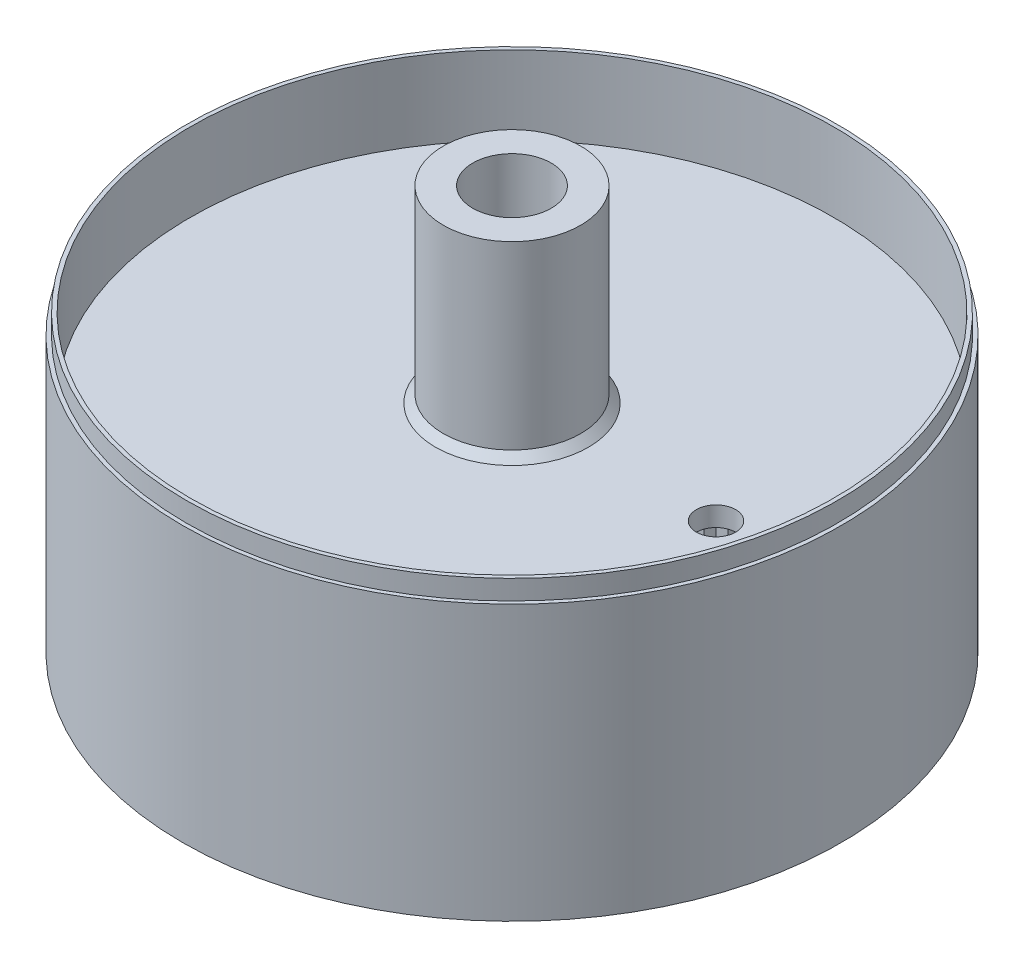
from build123d import *

# Parameters (mm, degrees)
CROQUIS1_R                = 84
SALIENTE_EXTRUIR1_DEPTH   = 5
SALIENTE_EXTRUIR2_START   = 20
CROQUIS5_R                = 84
CROQUIS5_R_2              = 82
SALIENTE_EXTRUIR2_DEPTH   = 20
CROQUIS20_R               = 17.5
EJE_ENGRANE_CENTRAL_DEPTH = 48
CROQUIS21_R               = 5
CORTAR_EXTRUIR2_DEPTH     = 15
CROQUIS23_R               = 84
CROQUIS23_R_2             = 83
CORTAR_EXTRUIR3_DEPTH     = 5
CROQUIS30_R               = 10
CORTAR_EXTRUIR8_DEPTH     = 73
CHAFL_N5_SIZE             = 2
CROQUIS33_R               = 84
CROQUIS33_R_2             = 81
SALIENTE_EXTRUIR7_DEPTH   = 50
SALIENTE_EXTRUIR8_DEPTH   = 32
CORTAR_EXTRUIR9_START     = -10
CROQUIS35_R               = 83
CROQUIS35_R_2             = 81
CORTAR_EXTRUIR9_DEPTH     = 10
ROSCA1_PITCH              = 1.5
CROQUIS37_R               = 1.5
SALIENTE_EXTRUIR9_DEPTH   = 10


with BuildPart() as part:
    # Croquis1 → Saliente-Extruir1 (new body)
    with BuildSketch(Plane(origin=(0, 0, 0), x_dir=(1, 0, 0), z_dir=(0, 1, 0))):
        with Locations(Location((0, 0, 0), (0, 0, 270))):
            Circle(CROQUIS1_R)
    extrude(amount=-SALIENTE_EXTRUIR1_DEPTH)

    # Croquis5 → Saliente-Extruir2 (add)
    with BuildSketch(Plane(origin=(0, 0, 0), x_dir=(1, 0, 0), z_dir=(0, 1, 0)).offset(SALIENTE_EXTRUIR2_START)):
        with Locations(Location((0, 0, 0), (0, 0, 270))):
            Circle(CROQUIS5_R)
        with Locations(Location((0, 0, 0), (0, 0, 270))):
            Circle(CROQUIS5_R_2, mode=Mode.SUBTRACT)
    extrude(amount=-SALIENTE_EXTRUIR2_DEPTH)

    # Croquis20 → Eje Engrane Central (add)
    with BuildSketch(Plane(origin=(0, 0, 0), x_dir=(1, 0, 0), z_dir=(0, 1, 0))):
        with Locations(Location((0, 0, 0), (0, 0, 270))):
            Circle(CROQUIS20_R)
    extrude(amount=EJE_ENGRANE_CENTRAL_DEPTH)

    # Croquis21 → Cortar-Extruir2 (cut)
    with BuildSketch(Plane(origin=(0, 0, 0), x_dir=(1, 0, 0), z_dir=(0, 1, 0))):
        with Locations(Location((52, 0, 0), (0, 0, 270))):
            Circle(CROQUIS21_R)
    extrude(amount=-CORTAR_EXTRUIR2_DEPTH, mode=Mode.SUBTRACT)

    # Croquis23 → Cortar-Extruir3 (cut)
    with BuildSketch(Plane(origin=(0, 20, 0), x_dir=(1, 0, 0), z_dir=(0, 1, 0))):
        with Locations(Location((0, 0, 0), (0, 0, 270))):
            Circle(CROQUIS23_R)
        with Locations(Location((0, 0, 0), (0, 0, 270))):
            Circle(CROQUIS23_R_2, mode=Mode.SUBTRACT)
    extrude(amount=-CORTAR_EXTRUIR3_DEPTH, mode=Mode.SUBTRACT)

    # Croquis30 → Cortar-Extruir8 (cut)
    with BuildSketch(Plane(origin=(0, 48, 0), x_dir=(1, 0, 0), z_dir=(0, 1, 0))):
        with Locations(Location((0, 0, 0), (0, 0, 270))):
            Circle(CROQUIS30_R)
    extrude(amount=-CORTAR_EXTRUIR8_DEPTH, mode=Mode.SUBTRACT)

    # Chaflán5
    chafl_n5_edges = [part.edges().sort_by_distance(p)[0] for p in [
        (0, 0, -17.5),
    ]]
    chamfer(chafl_n5_edges, length=CHAFL_N5_SIZE)

    # Croquis33 → Saliente-Extruir7 (add)
    with BuildSketch(Plane.XZ.offset(5)):
        with Locations(Location((0, 0, 0), (0, 0, 90))):
            Circle(CROQUIS33_R)
        with Locations(Location((0, 0, 0), (0, 0, 270))):
            Circle(CROQUIS33_R_2, mode=Mode.SUBTRACT)
    extrude(amount=SALIENTE_EXTRUIR7_DEPTH)

    # Croquis34 → Saliente-Extruir8 (add)
    with BuildSketch(Plane.XZ.offset(5)):
        Polygon((29.5, 17.5), (31.5, 17.5), (31.5, 20.5), (34.5, 20.5), (34.5, 22.5), (29.5, 22.5), align=None)
        Polygon((74.5, -22.5), (69.5, -22.5), (69.5, -20.5), (72.5, -20.5), (72.5, -17.5), (74.5, -17.5), align=None)
        Polygon((74.5, 22.5), (69.5, 22.5), (69.5, 20.5), (72.5, 20.5), (72.5, 17.5), (74.5, 17.5), align=None)
        Polygon((29.5, -22.5), (29.5, -17.5), (31.5, -17.5), (31.5, -20.5), (34.5, -20.5), (34.5, -22.5), align=None)
    extrude(amount=SALIENTE_EXTRUIR8_DEPTH)

    # Croquis35 → Cortar-Extruir9 (cut)
    with BuildSketch(Plane.XZ.offset(55).offset(CORTAR_EXTRUIR9_START)):
        with Locations(Location((0, 0, 0), (0, 0, 90))):
            Circle(CROQUIS35_R)
        with Locations(Location((0, 0, 0), (0, 0, 270))):
            Circle(CROQUIS35_R_2, mode=Mode.SUBTRACT)
    extrude(amount=CORTAR_EXTRUIR9_DEPTH, mode=Mode.SUBTRACT)

    # Rosca1: the profile of Perfil de rosca1 profile screwed along a right-hand helix of 6.666667 turns, 8 arcs to a turn; built about Z, then put on its axis
    rosca1_z = Axis((0, 0, 0), (0, 0, 1))
    rosca1_corners = [(83.0003, 0, -0.000173205), (83.0003, 0, 1.312673201), (82.188101187, 0, 0.843749998), (82.188101187, 0, 0.468749998)]
    with BuildLine(mode=Mode.PRIVATE) as rosca1_profile:
        Line(rosca1_corners[0], rosca1_corners[1])
        Line(rosca1_corners[1], rosca1_corners[2])
        Line(rosca1_corners[2], rosca1_corners[3])
        Line(rosca1_corners[3], rosca1_corners[0])
    rosca1_cap = Face(rosca1_profile.wire())
    rosca1_turn_angles = [0, 22.5, 45, 67.5, 90, 112.5, 135, 157.5, 180, 202.5, 225, 247.5, 270, 292.5, 315, 337.5, 360]
    rosca1_turn_weights = [1, 0.9238795325112867, 1, 0.9238795325112867, 1, 0.9238795325112867, 1, 0.9238795325112867, 1, 0.9238795325112867, 1, 0.9238795325112867, 1, 0.9238795325112867, 1, 0.9238795325112867, 1]
    rosca1_turn_rails = [Edge.make_bspline([Vector(p[0], p[1], 0).rotate(rosca1_z, rosca1_turn_angles[k]) / rosca1_turn_weights[k] + Vector(0, 0, p[2] + ROSCA1_PITCH * rosca1_turn_angles[k] / 360) for k in range(17)], [0, 0, 0, 1, 1, 2, 2, 3, 3, 4, 4, 5, 5, 6, 6, 7, 7, 8, 8, 8], 2, rosca1_turn_weights) for p in rosca1_corners]
    rosca1_turn_sides = [Face.make_surface_from_curves(rosca1_turn_rails[p[0]], rosca1_turn_rails[p[1]]) for p in [(0, 1), (1, 2), (2, 3), (3, 0)]]
    rosca1_last_angles = [2160, 2182.5, 2205, 2227.5, 2250, 2272.5, 2295, 2317.5, 2340, 2362.5, 2385, 2392.5, 2400]
    rosca1_last_weights = [1, 0.9238795325112867, 1, 0.9238795325112867, 1, 0.9238795325112867, 1, 0.9238795325112867, 1, 0.9238795325112867, 1, 0.9914448613738109, 1]
    rosca1_last_rails = [Edge.make_bspline([Vector(p[0], p[1], 0).rotate(rosca1_z, rosca1_last_angles[k]) / rosca1_last_weights[k] + Vector(0, 0, p[2] + ROSCA1_PITCH * rosca1_last_angles[k] / 360) for k in range(13)], [0, 0, 0, 1, 1, 2, 2, 3, 3, 4, 4, 5, 5, 6, 6, 6], 2, rosca1_last_weights) for p in rosca1_corners]
    rosca1_last_sides = [Face.make_surface_from_curves(rosca1_last_rails[p[0]], rosca1_last_rails[p[1]]) for p in [(0, 1), (1, 2), (2, 3), (3, 0)]]
    rosca1 = Plane(origin=(0, -55, 0), x_dir=(1, 0, 0), z_dir=(0, 1, 0)) * Solid(Shell([*[p.moved(Location((0, 0, ROSCA1_PITCH * i))) for i in range(6) for p in rosca1_turn_sides], *rosca1_last_sides, rosca1_cap, rosca1_cap.rotate(rosca1_z, 2400).moved(Location((0, 0, ROSCA1_PITCH * 2400 / 360)))]))
    add(rosca1)

    # Croquis37 → Saliente-Extruir9 (add)
    with BuildSketch(Plane(origin=(0, 0, 0), x_dir=(1, 0, 0), z_dir=(0, 1, 0))):
        with Locations(Location((-57, -33.028427125, 0), (0, 0, 270))):
            Circle(CROQUIS37_R)
        with Locations(Location((-71.7, 17.5, 0), (0, 0, 270))):
            Circle(CROQUIS37_R)
        with Locations(Location((-22.3, 18.5, 0), (0, 0, 270))):
            Circle(CROQUIS37_R)
        with Locations(Location((-27, -33.028427125, 0), (0, 0, 270))):
            Circle(CROQUIS37_R)
    extrude(amount=-SALIENTE_EXTRUIR9_DEPTH)


solid = part.part
